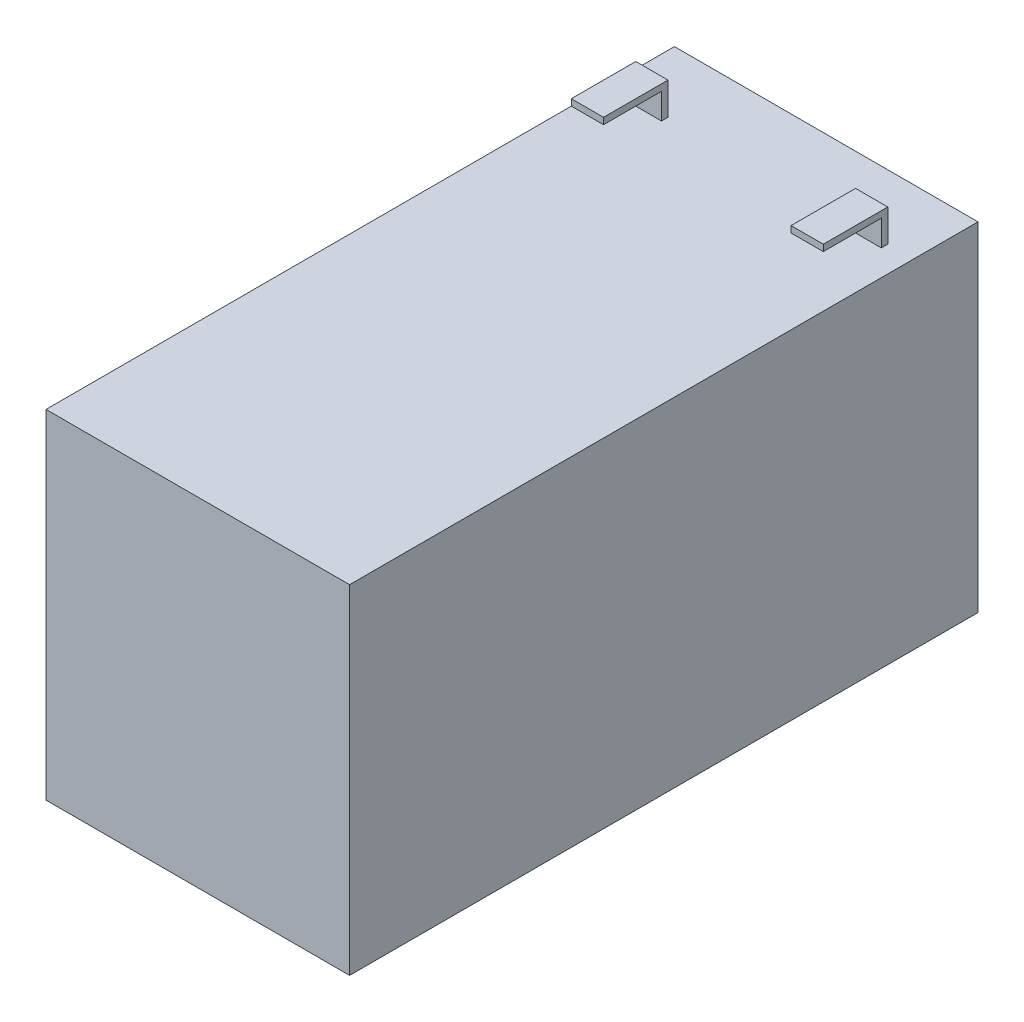
from build123d import *

# Parameters (mm, degrees)
SKETCH_1_W      = 47.1
SKETCH_1_H      = 97.5
EXTRUDE_1_DEPTH = 52.5
SKETCH_3_W      = 5
SKETCH_3_H      = 1


with BuildPart() as part:
    # 草图1 → 拉伸1 (new body)
    with BuildSketch(Plane(origin=(0, 0, 0), x_dir=(1, 0, 0), z_dir=(0, 1, 0))):
        Rectangle(SKETCH_1_W, SKETCH_1_H)
    extrude(amount=EXTRUDE_1_DEPTH)

    # 扫描1: sweep along a path in 草图4
    with BuildLine(Plane.ZY.offset(19.55)) as sweep_1_path:
        Line((-38.75, 52.5), (-38.75, 57.5))
        Line((-38.75, 57.5), (-28.75, 57.5))
    # 草图3 → 扫描1 (sweep)
    with BuildSketch(Plane(origin=(0, 52.5, 0), x_dir=(-1, 0, 0), z_dir=(0, 1, 0))):
        with Locations((17.05, -38.25)):
            Rectangle(SKETCH_3_W, SKETCH_3_H)
    sweep_1 = sweep(path=sweep_1_path.line, transition=Transition.RIGHT)

    # 镜向2: 扫描1 across plane
    add(sweep_1.mirror(Plane.ZY))


solid = part.part
